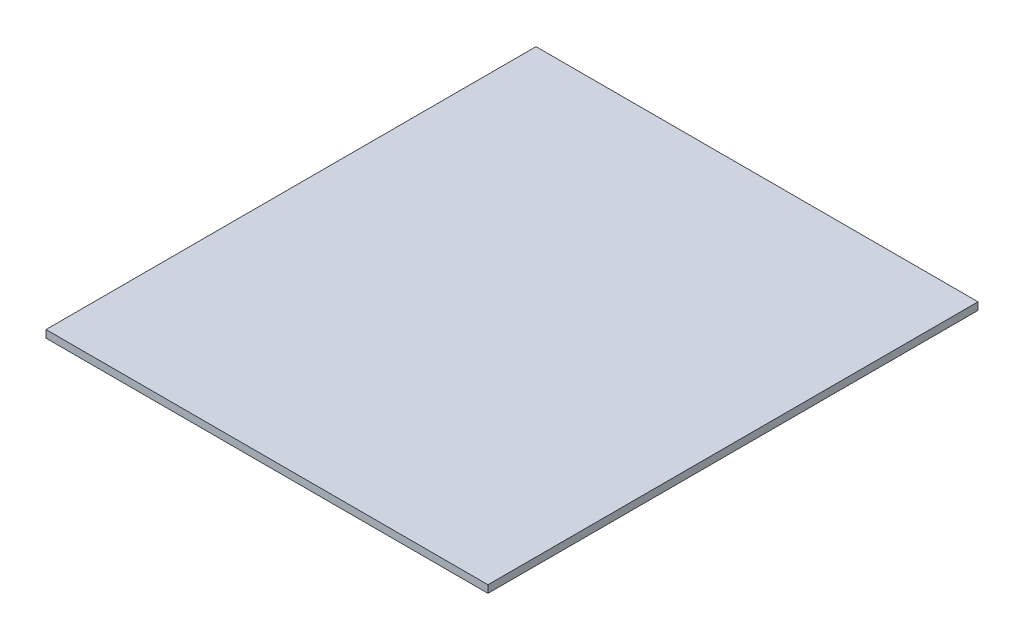
from build123d import *

# Parameters (mm, degrees)
SKETCH1_W           = 46
SKETCH1_H           = 51
BOSS_EXTRUDE1_DEPTH = 0.78


with BuildPart() as part:
    # Sketch1 → Boss-Extrude1 (new body)
    with BuildSketch(Plane(origin=(0, 0, 0), x_dir=(1, 0, 0), z_dir=(0, 1, 0))):
        Rectangle(SKETCH1_W, SKETCH1_H)
    extrude(amount=BOSS_EXTRUDE1_DEPTH)


solid = part.part
